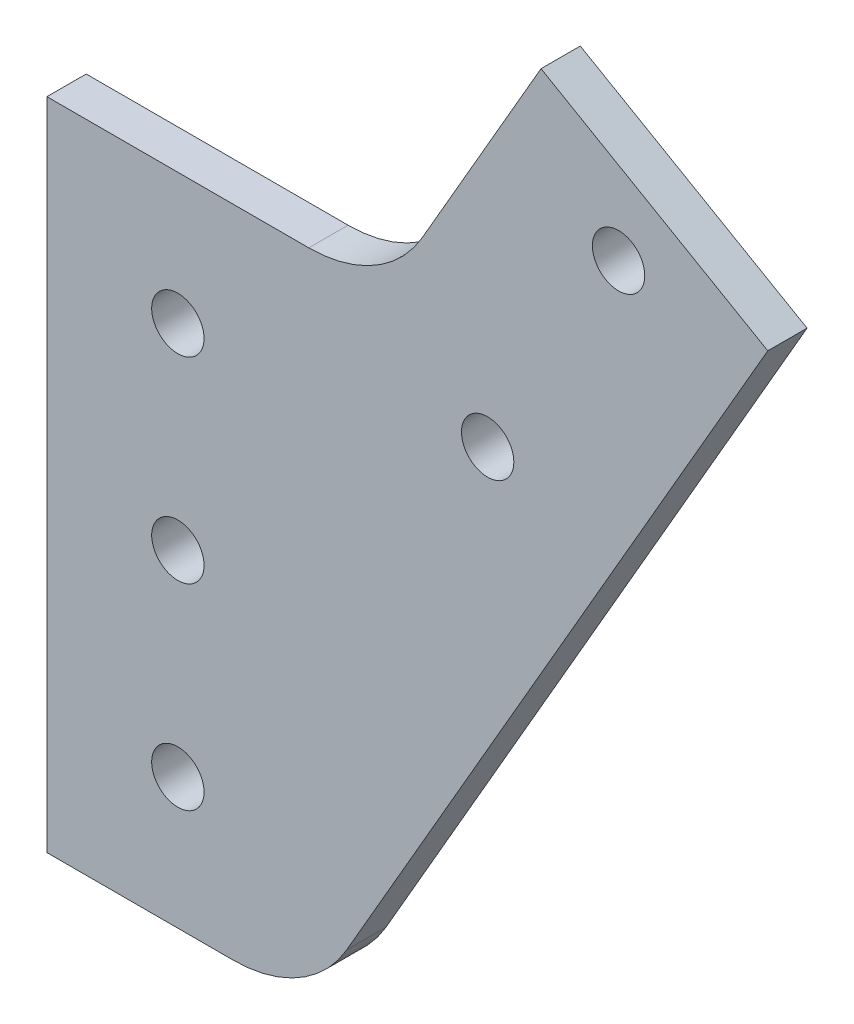
from build123d import *

# Parameters (mm, degrees)
SKETCH_1_R      = 2
SKETCH_1_W      = 20
SKETCH_1_H      = 50
EXTRUDE_1_DEPTH = 3
FILLET_1_R      = 10


with BuildPart() as part:
    # 草图1 → 凸台-拉伸1 (new body)
    # profile 1 of 3: a face of its own
    with BuildSketch(Plane.XY):
        Polygon((27.320508076, 5), (10, 15), (10, -25), align=None)
    # profile 2 of 3: a face of its own
    with BuildSketch(Plane.XY):
        Polygon((27.735682985, 45.719104037), (45.05619106, 35.719104037), (27.320508076, 5), (10, 15), align=None)
        with Locations((33.660254038, 35.980762114)):
            Circle(SKETCH_1_R, mode=Mode.SUBTRACT)
        with Locations((23.660254038, 18.660254038)):
            Circle(SKETCH_1_R, mode=Mode.SUBTRACT)
    # profile 3 of 3: a face of its own
    with BuildSketch(Plane.XY):
        Rectangle(SKETCH_1_W, SKETCH_1_H)
        Circle(SKETCH_1_R, mode=Mode.SUBTRACT)
        with Locations((0, -15)):
            Circle(SKETCH_1_R, mode=Mode.SUBTRACT)
        with Locations((0, 15)):
            Circle(SKETCH_1_R, mode=Mode.SUBTRACT)
    extrude(amount=EXTRUDE_1_DEPTH)

    # 圆角1
    # the kernel refuses this fillet: 10 mm, written as the material it adds along each edge
    with BuildSketch(Plane(origin=(10, 15, 0), x_dir=(0.49999999999999756, 0.86602540378444, 0), z_dir=(0, 0, 1))) as fillet_1_piece_1:
        with BuildLine():
            CenterArc((17.320508076, 10), FILLET_1_R, 210, 60)
            Line((8.660254038, 5), (0, 0))
            Line((0, 0), (17.320508076, 0))
        make_face()
    extrude(amount=3)
    # the kernel refuses this fillet: 10 mm, written as the material it takes off along each edge
    with BuildSketch(Plane(origin=(10, -25, -14.43375673), x_dir=(0.49999999999999745, 0.86602540378444, 0), z_dir=(0, 0, 1))) as fillet_1_2_piece_1:
        with BuildLine():
            CenterArc((FILLET_1_R * 0.57735026919, FILLET_1_R), FILLET_1_R, 210, 60)
            Line((-FILLET_1_R * 0.288675134595, FILLET_1_R * 0.5), (0, 0))
            Line((0, 0), (FILLET_1_R * 0.57735026919, 0))
        make_face()
    extrude(amount=31.867513459, mode=Mode.SUBTRACT)


solid = part.part
